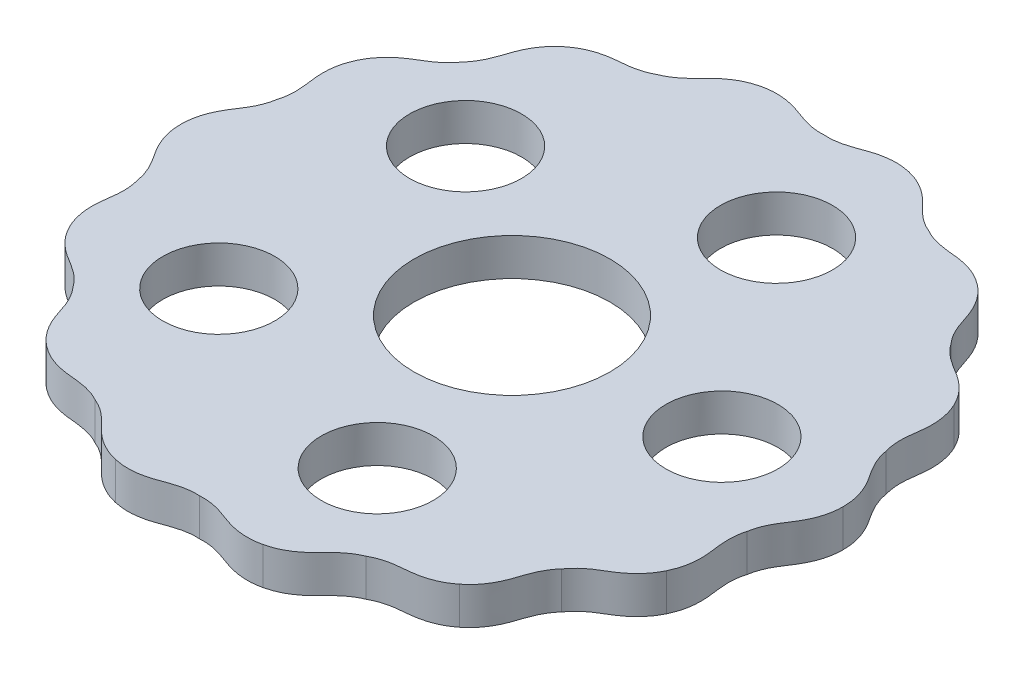
from build123d import *

# Parameters (mm, degrees)
BOSS_EXTRUDE3_DEPTH = 4
SKETCH2_R           = 10.5
SKETCH2_R_2         = 6
CUT_EXTRUDE1_DEPTH  = 5


with BuildPart() as part:
    # Sketch1 → Boss-Extrude3 (new body)
    with BuildSketch(Plane(origin=(0, 0, 0), x_dir=(1, 0, 0), z_dir=(0, 1, 0))):
        with BuildLine():
            Line((35.500002326, 0.003735881), (35.500002326, 0))
            Line((35.500002326, 0), (35.500002326, -0.003735881))
            add(Edge.make_bspline(
                [(32.644810899, -7.45096506), (32.674793712, -7.260710929), (32.757965618, -6.873262555), (32.975088878, -6.197475635), (33.30681421, -5.487322542), (33.693887271, -4.83935734), (34.139372051, -4.165162167), (34.499748971, -3.6014921), (34.870711868, -2.889611748), (35.149566879, -2.192738575), (35.418263863, -1.23361479), (35.50061524, -0.495919336), (35.500002326, -0.003735881)],
                knots=[0.02301065, 0.02301065, 0.02301065, 0.02301065, 0.053541567, 0.084072485, 0.145134319, 0.206196153, 0.267257988, 0.389381656, 0.511505325, 0.633628994, 0.755752663, 1, 1, 1, 1], degree=3))
            add(Edge.make_bspline(
                [(31.986017844, -15.399507835), (32.200120458, -14.956331799), (32.445998494, -14.255960238), (32.62005909, -13.275236314), (32.671181344, -12.526384626), (32.645828632, -11.724047822), (32.565707523, -11.059836954), (32.456861927, -10.25911949), (32.389262714, -9.507378309), (32.398512397, -8.723622254), (32.496104055, -8.020553026), (32.589276306, -7.635387164), (32.644810899, -7.45096506)],
                knots=[0.02301065, 0.02301065, 0.02301065, 0.02301065, 0.267257988, 0.389381656, 0.511505325, 0.633628994, 0.755752663, 0.816814497, 0.877876331, 0.938938166, 0.969469083, 1, 1, 1, 1], degree=3))
            Line((31.986017844, -15.399507835), (31.984396906, -15.402873748))
            Line((31.984396906, -15.402873748), (31.982775968, -15.406239661))
            add(Edge.make_bspline(
                [(26.179105738, -20.877140171), (26.288667493, -20.718736177), (26.531710341, -20.405744191), (27.020544594, -19.891087467), (27.62754267, -19.395191866), (28.257425012, -18.979340099), (28.951315253, -18.565199839), (29.520570914, -18.213712342), (30.163670245, -17.733285076), (30.717271866, -17.226414698), (31.375507699, -16.478857279), (31.769777787, -15.849947564), (31.982775968, -15.406239661)],
                knots=[0.02301065, 0.02301065, 0.02301065, 0.02301065, 0.053541567, 0.084072485, 0.145134319, 0.206196153, 0.267257988, 0.389381656, 0.511505325, 0.633628994, 0.755752663, 1, 1, 1, 1], degree=3))
            add(Edge.make_bspline(
                [(22.136810246, -27.752690162), (22.521996911, -27.446297993), (23.047405198, -26.921967502), (23.62974854, -26.113887841), (24.00072267, -25.461376898), (24.326001557, -24.727496287), (24.542005228, -24.094299727), (24.791357022, -23.325651886), (25.05662051, -22.619026286), (25.405013194, -21.916899767), (25.797990545, -21.325799714), (26.049053047, -21.019203188), (26.179105738, -20.877140171)],
                knots=[0.02301065, 0.02301065, 0.02301065, 0.02301065, 0.267257988, 0.389381656, 0.511505325, 0.633628994, 0.755752663, 0.816814497, 0.877876331, 0.938938166, 0.969469083, 1, 1, 1, 1], degree=3))
            Line((22.136810246, -27.752690162), (22.133889416, -27.755019446))
            Line((22.133889416, -27.755019446), (22.130968587, -27.75734873))
            add(Edge.make_bspline(
                [(14.52830762, -30.168341629), (14.695748267, -30.073161626), (15.05052444, -29.89661793), (15.714250068, -29.645025478), (16.476297475, -29.461605575), (17.224233175, -29.360231784), (18.029095404, -29.288171996), (18.694481743, -29.218483478), (19.482343797, -29.064663811), (20.201044438, -28.848188121), (21.118447439, -28.460259983), (21.746546212, -28.06469929), (22.130968587, -27.75734873)],
                knots=[0.02301065, 0.02301065, 0.02301065, 0.02301065, 0.053541567, 0.084072485, 0.145134319, 0.206196153, 0.267257988, 0.389381656, 0.511505325, 0.633628994, 0.755752663, 1, 1, 1, 1], degree=3))
            add(Edge.make_bspline(
                [(7.903135888, -34.609111839), (8.383115662, -34.500188263), (9.083990645, -34.255748926), (9.959276491, -33.780363616), (10.576626521, -33.353431213), (11.188111536, -32.833360849), (11.657457809, -32.356590942), (12.215619812, -31.772252855), (12.761207314, -31.250698702), (13.379739556, -30.769266488), (13.990268616, -30.407210225), (14.349495361, -30.239908237), (14.52830762, -30.168341629)],
                knots=[0.02301065, 0.02301065, 0.02301065, 0.02301065, 0.267257988, 0.389381656, 0.511505325, 0.633628994, 0.755752663, 0.816814497, 0.877876331, 0.938938166, 0.969469083, 1, 1, 1, 1], degree=3))
            Line((7.903135888, -34.609111839), (7.899493673, -34.60994315))
            Line((7.899493673, -34.60994315), (7.895851458, -34.610774462))
            add(Edge.make_bspline(
                [(0, -33.484333037), (0.192155866, -33.471228592), (0.588397592, -33.466099831), (1.295555593, -33.527402621), (2.061719496, -33.692786976), (2.779570716, -33.925969485), (3.535992098, -34.210262493), (4.165721189, -34.43617562), (4.942300224, -34.639429423), (5.683752409, -34.756224087), (6.678619663, -34.804759157), (7.416144457, -34.72089313), (7.895851458, -34.610774462)],
                knots=[0.02301065, 0.02301065, 0.02301065, 0.02301065, 0.053541567, 0.084072485, 0.145134319, 0.206196153, 0.267257988, 0.389381656, 0.511505325, 0.633628994, 0.755752663, 1, 1, 1, 1], degree=3))
            add(Edge.make_bspline(
                [(-7.895851458, -34.610774462), (-7.416144457, -34.72089313), (-6.678619663, -34.804759157), (-5.683752409, -34.756224087), (-4.942300224, -34.639429423), (-4.165721189, -34.43617562), (-3.535992098, -34.210262493), (-2.779570716, -33.925969485), (-2.061719496, -33.692786976), (-1.295555593, -33.527402621), (-0.588397592, -33.466099831), (-0.192155866, -33.471228592), (0, -33.484333037)],
                knots=[0.02301065, 0.02301065, 0.02301065, 0.02301065, 0.267257988, 0.389381656, 0.511505325, 0.633628994, 0.755752663, 0.816814497, 0.877876331, 0.938938166, 0.969469083, 1, 1, 1, 1], degree=3))
            Line((-7.895851458, -34.610774462), (-7.899493673, -34.60994315))
            Line((-7.899493673, -34.60994315), (-7.903135888, -34.609111839))
            add(Edge.make_bspline(
                [(-14.52830762, -30.168341629), (-14.349495361, -30.239908237), (-13.990268616, -30.407210225), (-13.379739556, -30.769266488), (-12.761207314, -31.250698702), (-12.215619812, -31.772252855), (-11.657457809, -32.356590942), (-11.188111536, -32.833360849), (-10.576626521, -33.353431213), (-9.959276491, -33.780363616), (-9.083990645, -34.255748926), (-8.383115662, -34.500188263), (-7.903135888, -34.609111839)],
                knots=[0.02301065, 0.02301065, 0.02301065, 0.02301065, 0.053541567, 0.084072485, 0.145134319, 0.206196153, 0.267257988, 0.389381656, 0.511505325, 0.633628994, 0.755752663, 1, 1, 1, 1], degree=3))
            add(Edge.make_bspline(
                [(-22.130968587, -27.75734873), (-21.746546212, -28.06469929), (-21.118447439, -28.460259983), (-20.201044438, -28.848188121), (-19.482343797, -29.064663811), (-18.694481743, -29.218483478), (-18.029095404, -29.288171996), (-17.224233175, -29.360231784), (-16.476297475, -29.461605575), (-15.714250068, -29.645025478), (-15.05052444, -29.89661793), (-14.695748267, -30.073161626), (-14.52830762, -30.168341629)],
                knots=[0.02301065, 0.02301065, 0.02301065, 0.02301065, 0.267257988, 0.389381656, 0.511505325, 0.633628994, 0.755752663, 0.816814497, 0.877876331, 0.938938166, 0.969469083, 1, 1, 1, 1], degree=3))
            Line((-22.130968587, -27.75734873), (-22.133889416, -27.755019446))
            Line((-22.133889416, -27.755019446), (-22.136810246, -27.752690162))
            add(Edge.make_bspline(
                [(-26.179105738, -20.877140171), (-26.049053047, -21.019203188), (-25.797990545, -21.325799714), (-25.405013194, -21.916899767), (-25.05662051, -22.619026286), (-24.791357022, -23.325651886), (-24.542005228, -24.094299727), (-24.326001557, -24.727496287), (-24.00072267, -25.461376898), (-23.62974854, -26.113887841), (-23.047405198, -26.921967502), (-22.521996911, -27.446297993), (-22.136810246, -27.752690162)],
                knots=[0.02301065, 0.02301065, 0.02301065, 0.02301065, 0.053541567, 0.084072485, 0.145134319, 0.206196153, 0.267257988, 0.389381656, 0.511505325, 0.633628994, 0.755752663, 1, 1, 1, 1], degree=3))
            add(Edge.make_bspline(
                [(-31.982775968, -15.406239661), (-31.769777787, -15.849947564), (-31.375507698, -16.478857279), (-30.717271866, -17.226414698), (-30.163670245, -17.733285076), (-29.520570914, -18.213712342), (-28.951315253, -18.565199839), (-28.257425012, -18.979340099), (-27.62754267, -19.395191866), (-27.020544594, -19.891087467), (-26.531710341, -20.405744191), (-26.288667493, -20.718736177), (-26.179105738, -20.877140171)],
                knots=[0.02301065, 0.02301065, 0.02301065, 0.02301065, 0.267257988, 0.389381656, 0.511505325, 0.633628994, 0.755752663, 0.816814497, 0.877876331, 0.938938166, 0.969469083, 1, 1, 1, 1], degree=3))
            Line((-31.982775968, -15.406239661), (-31.984396906, -15.402873748))
            Line((-31.984396906, -15.402873748), (-31.986017844, -15.399507835))
            add(Edge.make_bspline(
                [(-32.644810899, -7.45096506), (-32.589276306, -7.635387164), (-32.496104055, -8.020553026), (-32.398512397, -8.723622254), (-32.389262714, -9.507378309), (-32.456861927, -10.25911949), (-32.565707523, -11.059836954), (-32.645828632, -11.724047822), (-32.671181344, -12.526384626), (-32.62005909, -13.275236314), (-32.445998494, -14.255960238), (-32.200120458, -14.956331799), (-31.986017844, -15.399507835)],
                knots=[0.02301065, 0.02301065, 0.02301065, 0.02301065, 0.053541567, 0.084072485, 0.145134319, 0.206196153, 0.267257988, 0.389381656, 0.511505325, 0.633628994, 0.755752663, 1, 1, 1, 1], degree=3))
            add(Edge.make_bspline(
                [(-35.500002326, -0.003735881), (-35.50061524, -0.495919336), (-35.418263863, -1.23361479), (-35.149566879, -2.192738575), (-34.870711868, -2.889611748), (-34.499748971, -3.6014921), (-34.139372051, -4.165162167), (-33.693887271, -4.83935734), (-33.30681421, -5.487322542), (-32.975088878, -6.197475635), (-32.757965618, -6.873262555), (-32.674793712, -7.260710929), (-32.644810899, -7.45096506)],
                knots=[0.02301065, 0.02301065, 0.02301065, 0.02301065, 0.267257988, 0.389381656, 0.511505325, 0.633628994, 0.755752663, 0.816814497, 0.877876331, 0.938938166, 0.969469083, 1, 1, 1, 1], degree=3))
            Line((-35.500002326, -0.003735881), (-35.500002326, 0))
            Line((-35.500002326, 0), (-35.500002326, 0.003735881))
            add(Edge.make_bspline(
                [(-32.644810899, 7.45096506), (-32.674793712, 7.260710929), (-32.757965618, 6.873262555), (-32.975088878, 6.197475635), (-33.30681421, 5.487322542), (-33.693887271, 4.83935734), (-34.139372051, 4.165162167), (-34.499748971, 3.6014921), (-34.870711868, 2.889611748), (-35.149566879, 2.192738575), (-35.418263863, 1.23361479), (-35.50061524, 0.495919336), (-35.500002326, 0.003735881)],
                knots=[0.02301065, 0.02301065, 0.02301065, 0.02301065, 0.053541567, 0.084072485, 0.145134319, 0.206196153, 0.267257988, 0.389381656, 0.511505325, 0.633628994, 0.755752663, 1, 1, 1, 1], degree=3))
            add(Edge.make_bspline(
                [(-31.986017844, 15.399507835), (-32.200120458, 14.956331799), (-32.445998494, 14.255960238), (-32.62005909, 13.275236314), (-32.671181344, 12.526384626), (-32.645828632, 11.724047822), (-32.565707523, 11.059836954), (-32.456861927, 10.25911949), (-32.389262714, 9.507378309), (-32.398512397, 8.723622254), (-32.496104055, 8.020553026), (-32.589276306, 7.635387164), (-32.644810899, 7.45096506)],
                knots=[0.02301065, 0.02301065, 0.02301065, 0.02301065, 0.267257988, 0.389381656, 0.511505325, 0.633628994, 0.755752663, 0.816814497, 0.877876331, 0.938938166, 0.969469083, 1, 1, 1, 1], degree=3))
            Line((-31.986017844, 15.399507835), (-31.984396906, 15.402873748))
            Line((-31.984396906, 15.402873748), (-31.982775968, 15.406239661))
            add(Edge.make_bspline(
                [(-26.179105738, 20.877140171), (-26.288667493, 20.718736177), (-26.531710341, 20.405744191), (-27.020544594, 19.891087467), (-27.62754267, 19.395191866), (-28.257425012, 18.979340099), (-28.951315253, 18.565199839), (-29.520570914, 18.213712342), (-30.163670245, 17.733285076), (-30.717271866, 17.226414698), (-31.375507699, 16.478857278), (-31.769777787, 15.849947564), (-31.982775968, 15.406239661)],
                knots=[0.02301065, 0.02301065, 0.02301065, 0.02301065, 0.053541567, 0.084072485, 0.145134319, 0.206196153, 0.267257988, 0.389381656, 0.511505325, 0.633628994, 0.755752663, 1, 1, 1, 1], degree=3))
            add(Edge.make_bspline(
                [(-22.136810246, 27.752690162), (-22.521996911, 27.446297993), (-23.047405198, 26.921967502), (-23.62974854, 26.113887841), (-24.00072267, 25.461376898), (-24.326001557, 24.727496287), (-24.542005228, 24.094299727), (-24.791357022, 23.325651886), (-25.05662051, 22.619026286), (-25.405013194, 21.916899767), (-25.797990545, 21.325799714), (-26.049053047, 21.019203188), (-26.179105738, 20.877140171)],
                knots=[0.02301065, 0.02301065, 0.02301065, 0.02301065, 0.267257988, 0.389381656, 0.511505325, 0.633628994, 0.755752663, 0.816814497, 0.877876331, 0.938938166, 0.969469083, 1, 1, 1, 1], degree=3))
            Line((-22.136810246, 27.752690162), (-22.133889416, 27.755019446))
            Line((-22.133889416, 27.755019446), (-22.130968587, 27.75734873))
            add(Edge.make_bspline(
                [(-14.52830762, 30.168341629), (-14.695748267, 30.073161626), (-15.05052444, 29.89661793), (-15.714250068, 29.645025478), (-16.476297475, 29.461605575), (-17.224233175, 29.360231784), (-18.029095404, 29.288171996), (-18.694481743, 29.218483478), (-19.482343797, 29.064663811), (-20.201044438, 28.848188121), (-21.118447439, 28.460259983), (-21.746546212, 28.06469929), (-22.130968587, 27.75734873)],
                knots=[0.02301065, 0.02301065, 0.02301065, 0.02301065, 0.053541567, 0.084072485, 0.145134319, 0.206196153, 0.267257988, 0.389381656, 0.511505325, 0.633628994, 0.755752663, 1, 1, 1, 1], degree=3))
            add(Edge.make_bspline(
                [(-7.903135888, 34.609111839), (-8.383115662, 34.500188263), (-9.083990645, 34.255748926), (-9.959276491, 33.780363616), (-10.576626521, 33.353431213), (-11.188111536, 32.833360849), (-11.657457809, 32.356590942), (-12.215619812, 31.772252855), (-12.761207314, 31.250698702), (-13.379739556, 30.769266488), (-13.990268616, 30.407210225), (-14.349495361, 30.239908237), (-14.52830762, 30.168341629)],
                knots=[0.02301065, 0.02301065, 0.02301065, 0.02301065, 0.267257988, 0.389381656, 0.511505325, 0.633628994, 0.755752663, 0.816814497, 0.877876331, 0.938938166, 0.969469083, 1, 1, 1, 1], degree=3))
            Line((-7.903135888, 34.609111839), (-7.899493673, 34.60994315))
            Line((-7.899493673, 34.60994315), (-7.895851458, 34.610774462))
            add(Edge.make_bspline(
                [(0, 33.484333037), (-0.192155866, 33.471228592), (-0.588397592, 33.466099831), (-1.295555593, 33.527402621), (-2.061719496, 33.692786976), (-2.779570716, 33.925969485), (-3.535992098, 34.210262493), (-4.165721189, 34.43617562), (-4.942300224, 34.639429423), (-5.683752409, 34.756224087), (-6.678619663, 34.804759157), (-7.416144457, 34.72089313), (-7.895851458, 34.610774462)],
                knots=[0.02301065, 0.02301065, 0.02301065, 0.02301065, 0.053541567, 0.084072485, 0.145134319, 0.206196153, 0.267257988, 0.389381656, 0.511505325, 0.633628994, 0.755752663, 1, 1, 1, 1], degree=3))
            add(Edge.make_bspline(
                [(7.895851458, 34.610774462), (7.416144457, 34.72089313), (6.678619663, 34.804759157), (5.683752409, 34.756224087), (4.942300224, 34.639429423), (4.165721189, 34.43617562), (3.535992098, 34.210262493), (2.779570716, 33.925969485), (2.061719496, 33.692786976), (1.295555593, 33.527402621), (0.588397592, 33.466099831), (0.192155866, 33.471228592), (0, 33.484333037)],
                knots=[0.02301065, 0.02301065, 0.02301065, 0.02301065, 0.267257988, 0.389381656, 0.511505325, 0.633628994, 0.755752663, 0.816814497, 0.877876331, 0.938938166, 0.969469083, 1, 1, 1, 1], degree=3))
            Line((7.895851458, 34.610774462), (7.899493673, 34.60994315))
            Line((7.899493673, 34.60994315), (7.903135888, 34.609111839))
            add(Edge.make_bspline(
                [(14.52830762, 30.168341629), (14.349495361, 30.239908237), (13.990268616, 30.407210225), (13.379739556, 30.769266488), (12.761207314, 31.250698702), (12.215619812, 31.772252855), (11.657457809, 32.356590942), (11.188111536, 32.833360849), (10.576626521, 33.353431213), (9.959276491, 33.780363616), (9.083990645, 34.255748926), (8.383115662, 34.500188263), (7.903135888, 34.609111839)],
                knots=[0.02301065, 0.02301065, 0.02301065, 0.02301065, 0.053541567, 0.084072485, 0.145134319, 0.206196153, 0.267257988, 0.389381656, 0.511505325, 0.633628994, 0.755752663, 1, 1, 1, 1], degree=3))
            add(Edge.make_bspline(
                [(22.130968587, 27.75734873), (21.746546212, 28.06469929), (21.118447439, 28.460259983), (20.201044438, 28.848188121), (19.482343797, 29.064663811), (18.694481743, 29.218483478), (18.029095404, 29.288171996), (17.224233175, 29.360231784), (16.476297475, 29.461605575), (15.714250068, 29.645025478), (15.05052444, 29.89661793), (14.695748267, 30.073161626), (14.52830762, 30.168341629)],
                knots=[0.02301065, 0.02301065, 0.02301065, 0.02301065, 0.267257988, 0.389381656, 0.511505325, 0.633628994, 0.755752663, 0.816814497, 0.877876331, 0.938938166, 0.969469083, 1, 1, 1, 1], degree=3))
            Line((22.130968587, 27.75734873), (22.133889416, 27.755019446))
            Line((22.133889416, 27.755019446), (22.136810246, 27.752690162))
            add(Edge.make_bspline(
                [(26.179105738, 20.877140171), (26.049053047, 21.019203188), (25.797990545, 21.325799714), (25.405013194, 21.916899767), (25.05662051, 22.619026286), (24.791357022, 23.325651886), (24.542005228, 24.094299727), (24.326001557, 24.727496287), (24.00072267, 25.461376898), (23.62974854, 26.113887841), (23.047405198, 26.921967502), (22.521996911, 27.446297993), (22.136810246, 27.752690162)],
                knots=[0.02301065, 0.02301065, 0.02301065, 0.02301065, 0.053541567, 0.084072485, 0.145134319, 0.206196153, 0.267257988, 0.389381656, 0.511505325, 0.633628994, 0.755752663, 1, 1, 1, 1], degree=3))
            add(Edge.make_bspline(
                [(31.982775968, 15.406239661), (31.769777787, 15.849947564), (31.375507698, 16.478857279), (30.717271866, 17.226414698), (30.163670245, 17.733285076), (29.520570914, 18.213712342), (28.951315253, 18.565199839), (28.257425012, 18.979340099), (27.62754267, 19.395191866), (27.020544594, 19.891087467), (26.531710341, 20.405744191), (26.288667493, 20.718736177), (26.179105738, 20.877140171)],
                knots=[0.02301065, 0.02301065, 0.02301065, 0.02301065, 0.267257988, 0.389381656, 0.511505325, 0.633628994, 0.755752663, 0.816814497, 0.877876331, 0.938938166, 0.969469083, 1, 1, 1, 1], degree=3))
            Line((31.982775968, 15.406239661), (31.984396906, 15.402873748))
            Line((31.984396906, 15.402873748), (31.986017844, 15.399507835))
            add(Edge.make_bspline(
                [(32.644810899, 7.45096506), (32.589276306, 7.635387164), (32.496104055, 8.020553026), (32.398512397, 8.723622254), (32.389262714, 9.507378309), (32.456861927, 10.25911949), (32.565707523, 11.059836954), (32.645828632, 11.724047822), (32.671181344, 12.526384626), (32.62005909, 13.275236314), (32.445998494, 14.255960238), (32.200120458, 14.956331799), (31.986017844, 15.399507835)],
                knots=[0.02301065, 0.02301065, 0.02301065, 0.02301065, 0.053541567, 0.084072485, 0.145134319, 0.206196153, 0.267257988, 0.389381656, 0.511505325, 0.633628994, 0.755752663, 1, 1, 1, 1], degree=3))
            add(Edge.make_bspline(
                [(35.500002326, 0.003735881), (35.50061524, 0.495919336), (35.418263863, 1.23361479), (35.149566879, 2.192738575), (34.870711868, 2.889611748), (34.499748971, 3.6014921), (34.139372051, 4.165162167), (33.693887271, 4.83935734), (33.30681421, 5.487322542), (32.975088878, 6.197475635), (32.757965618, 6.873262555), (32.674793712, 7.260710929), (32.644810899, 7.45096506)],
                knots=[0.02301065, 0.02301065, 0.02301065, 0.02301065, 0.267257988, 0.389381656, 0.511505325, 0.633628994, 0.755752663, 0.816814497, 0.877876331, 0.938938166, 0.969469083, 1, 1, 1, 1], degree=3))
        make_face()
    extrude(amount=BOSS_EXTRUDE3_DEPTH)

    # Sketch2 → Cut-Extrude1 (cut)
    with BuildSketch(Plane(origin=(0, 4, 0), x_dir=(1, 0, 0), z_dir=(0, 1, 0))):
        Circle(SKETCH2_R)
        with Locations((22.5, 0)):
            Circle(SKETCH2_R_2)
        with Locations((6.952882373, -21.398771617)):
            Circle(SKETCH2_R_2)
        with Locations((-18.202882373, -13.225168177)):
            Circle(SKETCH2_R_2)
        with Locations((-18.202882373, 13.225168177)):
            Circle(SKETCH2_R_2)
        with Locations((6.952882373, 21.398771617)):
            Circle(SKETCH2_R_2)
    extrude(amount=-CUT_EXTRUDE1_DEPTH, mode=Mode.SUBTRACT)


solid = part.part
